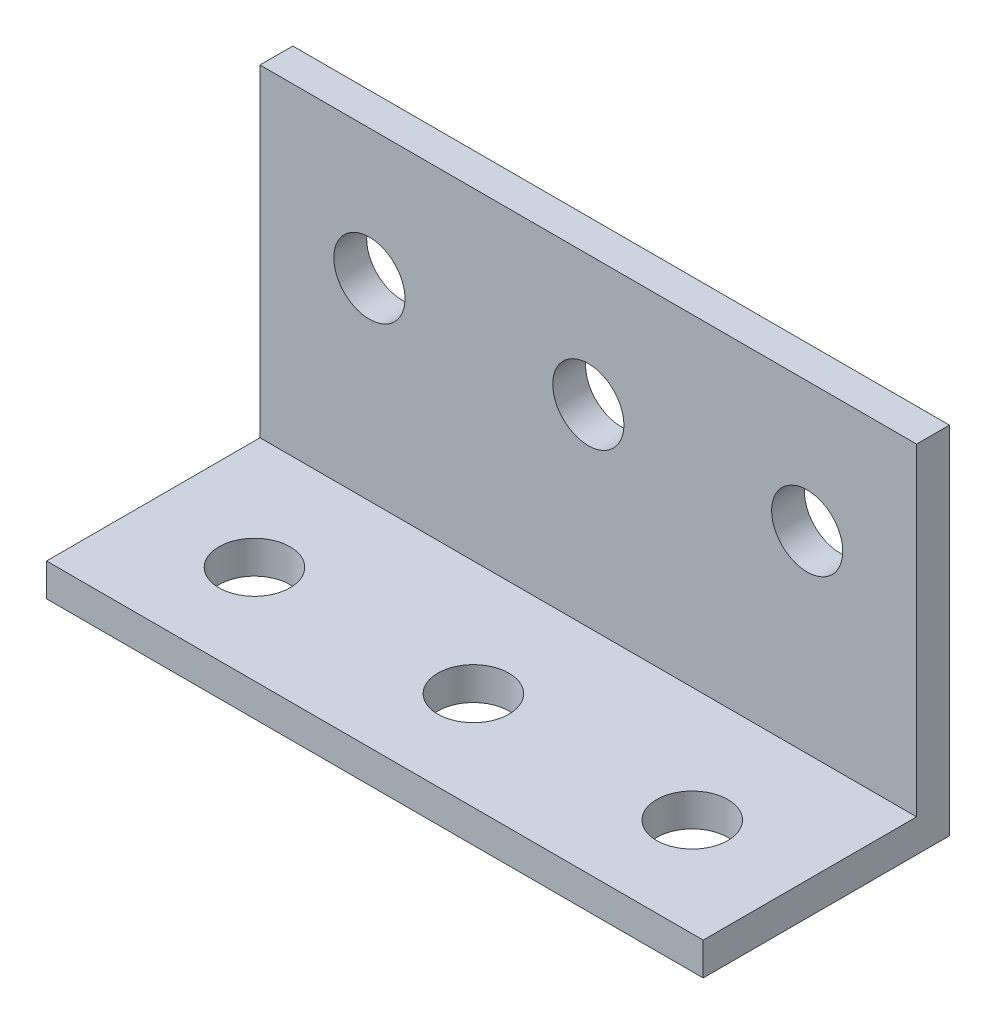
from build123d import *

# Parameters (mm, degrees)
SKETCH_1_W             = 240
SKETCH_1_H             = 130
EXTRUDE_1_DEPTH        = 90
SKETCH_2_W             = 78
SKETCH_2_H             = 118
CUT_EXTRUDE_1_DEPTH    = 288.402157264
SKETCH_3_R             = 13
CUT_EXTRUDE_2_DEPTH    = 288.402157264
PATTERN_LINEAR_1_COUNT = 3
PATTERN_LINEAR_1_PITCH = 80
SKETCH_4_R             = 13
CUT_EXTRUDE_3_DEPTH    = 288.402157264
PATTERN_LINEAR_2_COUNT = 3
PATTERN_LINEAR_2_PITCH = 80


with BuildPart() as part:
    # 草图1 → 凸台-拉伸1 (new body)
    with BuildSketch(Plane.XY):
        with Locations((120, 65)):
            Rectangle(SKETCH_1_W, SKETCH_1_H)
    extrude(amount=EXTRUDE_1_DEPTH)

    # 草图2 → 切除-拉伸1 (cut, through all)
    with BuildSketch(Plane.ZY):
        with Locations((51, 71)):
            Rectangle(SKETCH_2_W, SKETCH_2_H)
    extrude(amount=-CUT_EXTRUDE_1_DEPTH, mode=Mode.SUBTRACT)

    # 草图3 → 切除-拉伸2 (cut, through all)
    with BuildSketch(Plane(origin=(0, 0, 0), x_dir=(-1, 0, 0), z_dir=(0, 0, -1))):
        with Locations((-200, 82.5)):
            Circle(SKETCH_3_R)
    cut_extrude_2 = extrude(amount=-CUT_EXTRUDE_2_DEPTH, mode=Mode.SUBTRACT)

    # 阵列(线性)1: 切除-拉伸2 ×3
    with Locations(*[(-i * PATTERN_LINEAR_1_PITCH, 0, 0) for i in range(1, PATTERN_LINEAR_1_COUNT)]):
        add(cut_extrude_2, mode=Mode.SUBTRACT)

    # 草图4 → 切除-拉伸3 (cut, through all)
    with BuildSketch(Plane.XZ):
        with Locations((40, 54)):
            Circle(SKETCH_4_R)
    cut_extrude_3 = extrude(amount=-CUT_EXTRUDE_3_DEPTH, mode=Mode.SUBTRACT)

    # 阵列(线性)2: 切除-拉伸3 ×3
    with Locations(*[(i * PATTERN_LINEAR_2_PITCH, 0, 0) for i in range(1, PATTERN_LINEAR_2_COUNT)]):
        add(cut_extrude_3, mode=Mode.SUBTRACT)


solid = part.part
